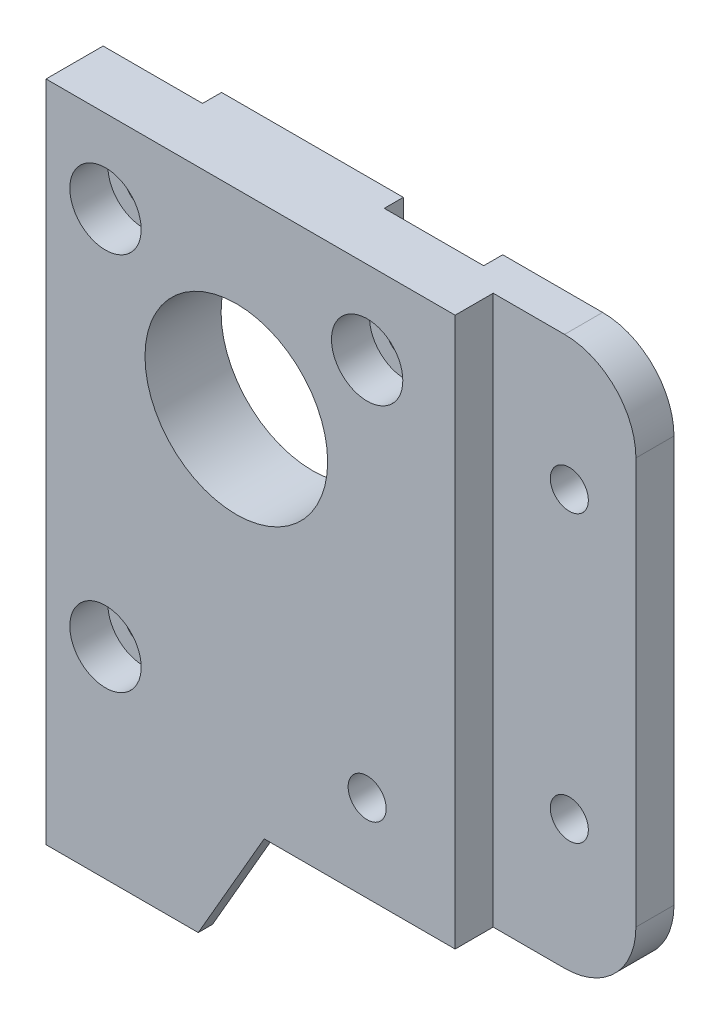
from build123d import *

# Parameters (mm, degrees)
SKETCH1_R           = 4.2
SKETCH1_R_2         = 9.6
BOSS_EXTRUDE1_DEPTH = 2
SKETCH4_W           = 58
SKETCH4_H           = 57.7
SKETCH4_R           = 2
SKETCH4_R_2         = 9.6
BOSS_EXTRUDE3_DEPTH = 2
SKETCH5_R           = 2
CUT_EXTRUDE1_DEPTH  = 4
SKETCH6_W           = 43
SKETCH6_H           = 57.7
SKETCH6_R           = 3.75
SKETCH6_R_2         = 9.6
SKETCH6_R_3         = 2
BOSS_EXTRUDE4_DEPTH = 4
CUT_EXTRUDE2_DEPTH  = 48.878204854
BOSS_EXTRUDE5_DEPTH = 6
BOSS_EXTRUDE6_DEPTH = 1.5


with BuildPart() as part:
    # Sketch1 → Boss-Extrude1 (new body)
    with BuildSketch(Plane.XY):
        with BuildLine():
            Line((38, 28.85), (20, 28.85))
            Line((20, 28.85), (20, 21.79369023))
            Line((20, 21.79369023), (17.201699017, 17.757141063))
            ThreePointArc((17.201699017, 17.757141063), (12.496432266, 16.141438171), (9.55, 20.15))
            Line((9.55, 20.15), (9.55, 28.85))
            Line((9.55, 28.85), (-9.55, 28.85))
            Line((-9.55, 28.85), (-9.55, 20.15))
            ThreePointArc((-9.55, 20.15), (-12.496432266, 16.141438171), (-17.201699017, 17.757141063))
            Line((-17.201699017, 17.757141063), (-20, 21.79369023))
            Line((-20, 21.79369023), (-20, -16.371914064))
            Line((-20, -16.371914064), (-16.312, -16.371914064))
            Line((-16.312, -16.371914064), (-12.349992933, -13.321914064))
            ThreePointArc((-12.349992933, -13.321914064), (-6.459906996, -14.088), (-7.225992933, -19.978085936))
            Line((-7.225992933, -19.978085936), (-11.188, -23.028085936))
            ThreePointArc((-11.188, -23.028085936), (-12.396848296, -23.676050863), (-13.75, -23.9))
            Line((-13.75, -23.9), (-13.75, -28.85))
            Line((-13.75, -28.85), (9.55, -28.85))
            Line((9.55, -28.85), (9.55, -19.7))
            ThreePointArc((9.55, -19.7), (12.496432266, -15.691438171), (17.201699017, -17.307141063))
            Line((17.201699017, -17.307141063), (20, -21.34369023))
            Line((20, -21.34369023), (20, -28.85))
            Line((20, -28.85), (38, -28.85))
            Line((38, -28.85), (38, 28.85))
        make_face()
        with Locations((-5.725, -6.1)):
            Circle(SKETCH1_R, mode=Mode.SUBTRACT)
        with Locations((5.725, -6.1)):
            Circle(SKETCH1_R, mode=Mode.SUBTRACT)
        with Locations((0, 8.8)):
            Circle(SKETCH1_R_2, mode=Mode.SUBTRACT)
    extrude(amount=BOSS_EXTRUDE1_DEPTH)

    # Sketch4 → Boss-Extrude3 (add)
    with BuildSketch(Plane.XY.offset(2)):
        with Locations((9, 0)):
            Rectangle(SKETCH4_W, SKETCH4_H)
        with Locations((13.75, -19.7)):
            Circle(SKETCH4_R, mode=Mode.SUBTRACT)
        with Locations((-13.75, 20.15)):
            Circle(SKETCH4_R, mode=Mode.SUBTRACT)
        with Locations((13.75, 20.15)):
            Circle(SKETCH4_R, mode=Mode.SUBTRACT)
        with Locations((-13.75, -19.7)):
            Circle(SKETCH4_R, mode=Mode.SUBTRACT)
        with Locations((0, 8.8)):
            Circle(SKETCH4_R_2, mode=Mode.SUBTRACT)
    extrude(amount=BOSS_EXTRUDE3_DEPTH)

    # Sketch5 → Cut-Extrude1 (cut)
    with BuildSketch(Plane.XY.offset(4)):
        with Locations((31, 15)):
            Circle(SKETCH5_R)
        with Locations((31, -15)):
            Circle(SKETCH5_R)
    extrude(amount=-CUT_EXTRUDE1_DEPTH, mode=Mode.SUBTRACT)

    # Sketch6 → Boss-Extrude4 (add)
    with BuildSketch(Plane.XY.offset(4)):
        with Locations((1.5, 0)):
            Rectangle(SKETCH6_W, SKETCH6_H)
        with Locations((-13.75, -19.7)):
            Circle(SKETCH6_R, mode=Mode.SUBTRACT)
        with Locations((0, 8.8)):
            Circle(SKETCH6_R_2, mode=Mode.SUBTRACT)
        with Locations((-13.75, 20.15)):
            Circle(SKETCH6_R, mode=Mode.SUBTRACT)
        with Locations((13.75, 20.15)):
            Circle(SKETCH6_R, mode=Mode.SUBTRACT)
        with Locations((13.75, -19.7)):
            Circle(SKETCH6_R_3, mode=Mode.SUBTRACT)
    extrude(amount=BOSS_EXTRUDE4_DEPTH)

    # Sketch7 → Cut-Extrude2 (cut, through all)
    with BuildSketch(Plane.XY.offset(4)):
        with BuildLine():
            Line((30.5, 28.85), (38, 28.85))
            Line((38, 28.85), (38, 21.35))
            ThreePointArc((38, 21.35), (35.803300859, 26.653300859), (30.5, 28.85))
        make_face()
        with BuildLine():
            Line((38, -28.85), (38, -21.35))
            ThreePointArc((38, -21.35), (35.803300859, -26.653300859), (30.5, -28.85))
            Line((30.5, -28.85), (38, -28.85))
        make_face()
    extrude(amount=-CUT_EXTRUDE2_DEPTH, mode=Mode.SUBTRACT)

    # Sketch9 → Boss-Extrude5 (add)
    with BuildSketch(Plane.ZY.offset(20)):
        Polygon((8, -28.85), (8, -40.85), (0, -40.85), (0, -35.15), (2, -35.15), (2, -28.85), align=None)
    extrude(amount=-BOSS_EXTRUDE5_DEPTH)

    # Sketch10 → Boss-Extrude6 (add)
    with BuildSketch(Plane.XY.offset(8)):
        Polygon((-14, -40.85), (-4, -40.85), (2.92820323, -28.85), (-14, -28.85), align=None)
    extrude(amount=-BOSS_EXTRUDE6_DEPTH)


solid = part.part
